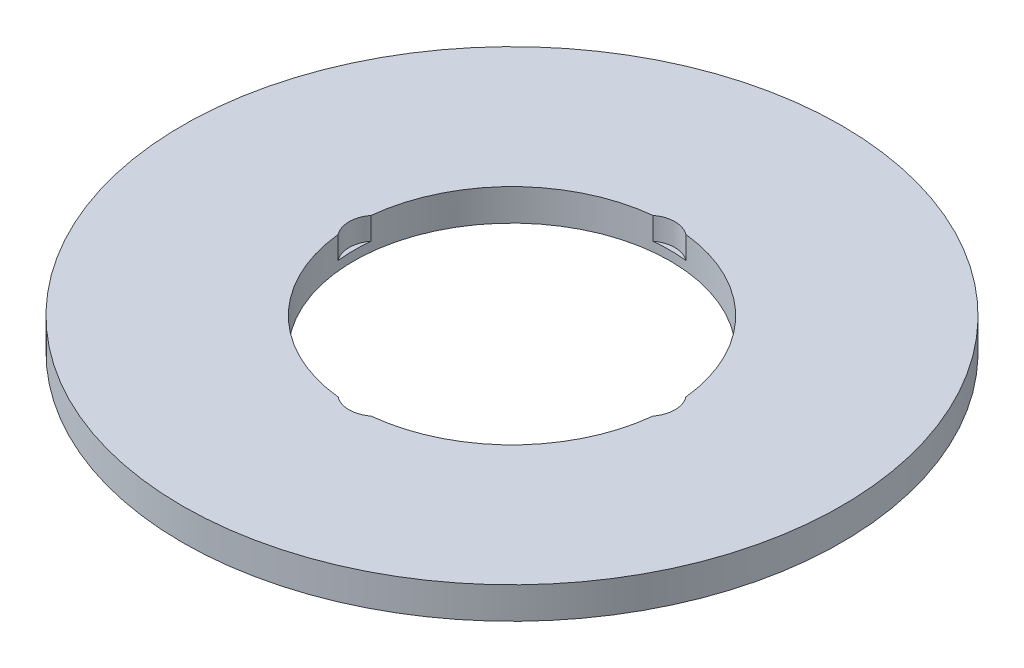
from build123d import *

# Parameters (mm, degrees)
SKETCH1_R           = 62.5
BOSS_EXTRUDE1_DEPTH = 6
SKETCH2_R           = 30
CUT_EXTRUDE1_DEPTH  = 89.591760339
SKETCH3_R           = 5.118084163
CUT_EXTRUDE2_DEPTH  = 4.250606843
CIRPATTERN1_COUNT   = 4


with BuildPart() as part:
    # Sketch1 → Boss-Extrude1 (new body)
    with BuildSketch(Plane(origin=(0, 0, 0), x_dir=(1, 0, 0), z_dir=(0, 1, 0))):
        Circle(SKETCH1_R)
    extrude(amount=BOSS_EXTRUDE1_DEPTH)

    # Sketch2 → Cut-Extrude1 (cut, through all)
    with BuildSketch(Plane(origin=(0, 0, 0), x_dir=(1, 0, 0), z_dir=(0, 1, 0))):
        Circle(SKETCH2_R)
    extrude(amount=CUT_EXTRUDE1_DEPTH, mode=Mode.SUBTRACT)

    # Sketch3 → Cut-Extrude2 (cut)
    with BuildSketch(Plane(origin=(0, 6, 0), x_dir=(1, 0, 0), z_dir=(0, 1, 0))):
        with Locations((-25.78467803, 0)):
            Circle(SKETCH3_R)
    cut_extrude2 = extrude(amount=-CUT_EXTRUDE2_DEPTH, mode=Mode.SUBTRACT)

    # CirPattern1: Cut-Extrude2 ×4 about axis
    cirpattern1_axis = Axis((0, 0, 0), (0, 1, 0))
    for i in range(1, CIRPATTERN1_COUNT):
        add(cut_extrude2.rotate(cirpattern1_axis, i * 360 / CIRPATTERN1_COUNT), mode=Mode.SUBTRACT)


solid = part.part
